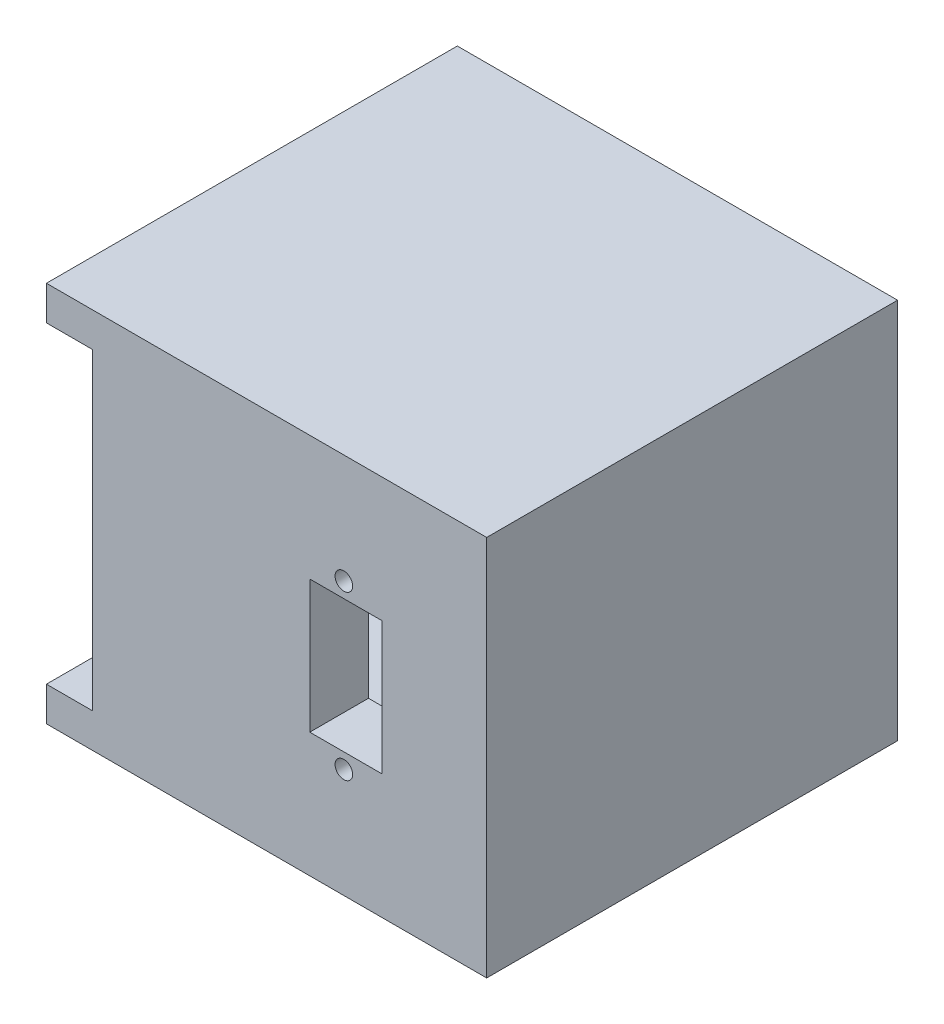
from build123d import *

# Parameters (mm, degrees)
SKIZZE1_W                       = 75
SKIZZE1_H                       = 65
AUFSATZ_LINEAR_AUSTRAGEN1_DEPTH = 70
SKIZZE4_W                       = 54.15
SKIZZE4_H                       = 53.3
SCHNITT_LINEAR_AUSTRAGEN1_DEPTH = 73
SKIZZE9_W                       = 3
SKIZZE9_H                       = 1
AUFSATZ_LINEAR_AUSTRAGEN2_DEPTH = 73
SCHNITT_LINEAR_AUSTRAGEN3_REACH = 117.974
SKIZZE12_W                      = 7.812260402
SKIZZE12_H                      = 53.3
SCHNITT_LINEAR_AUSTRAGEN4_REACH = 123.45
SKIZZE15_W                      = 12.3
SKIZZE15_H                      = 22.6


# Read off the part's stored shape, not the designer's step: Ø3.0 (3) Durchmesser Bohrung1, Ø3.0 (3) Durchmesser Bohrung2
with BuildPart() as part:
    # Skizze1 → Aufsatz-Linear austragen1 (new body)
    with BuildSketch(Plane.XY):
        with Locations((37.5, 32.5)):
            Rectangle(SKIZZE1_W, SKIZZE1_H)
    extrude(amount=AUFSATZ_LINEAR_AUSTRAGEN1_DEPTH)

    # Skizze4 → Schnitt-Linear austragen1 (cut)
    with BuildSketch(Plane.ZY):
        with Locations((32.925, 32.5)):
            Rectangle(SKIZZE4_W, SKIZZE4_H)
    extrude(amount=-SCHNITT_LINEAR_AUSTRAGEN1_DEPTH, mode=Mode.SUBTRACT)

    # Skizze9 → Aufsatz-Linear austragen2 (add)
    with BuildSketch(Plane.ZY):
        with Locations((12.35, 58.65)):
            Rectangle(SKIZZE9_W, SKIZZE9_H)
        with Locations((12.35, 6.35)):
            Rectangle(SKIZZE9_W, SKIZZE9_H)
    extrude(amount=-AUFSATZ_LINEAR_AUSTRAGEN2_DEPTH)

    # Skizze12 → Schnitt-Linear austragen3 (cut, up to next)
    with BuildSketch(Plane(origin=(0, 0, 60), x_dir=(-1, 0, 0), z_dir=(0, 0, -1)), mode=Mode.PRIVATE) as schnitt_linear_austragen3_sk1:
        with Locations((-3.906130201, 32.5)):
            Rectangle(SKIZZE12_W, SKIZZE12_H)
    schnitt_linear_austragen3_tool1 = extrude(schnitt_linear_austragen3_sk1.sketch, amount=-SCHNITT_LINEAR_AUSTRAGEN3_REACH, mode=Mode.PRIVATE) & part.part
    add(schnitt_linear_austragen3_tool1.solids().sort_by_distance((3.90613, 32.5, 60))[0], mode=Mode.SUBTRACT)

    # Ø3.0 (3) Durchmesser Bohrung1 outline → Ø3.0 (3) Durchmesser Bohrung1 (revolve, cut)
    with BuildSketch(Plane(origin=(50.669703956, 18.6, 0), x_dir=(1, 0, 0), z_dir=(0, -1, 0))):
        Polygon((0, 70), (0, 61.098709071), (1.5, 62), (1.5, 70), align=None)
    revolve(axis=Axis((50.669703956, 18.6, 0), (0, 0, 1)), mode=Mode.SUBTRACT)

    # 3.0 _3_ Durchmesser Bohrung1 2 outline → 3.0 _3_ Durchmesser Bohrung1 2 (revolve, cut)
    with BuildSketch(Plane(origin=(50.669703956, 46.4, 0), x_dir=(1, 0, 0), z_dir=(0, -1, 0))):
        Polygon((0, 70), (0, 61.098709071), (1.5, 62), (1.5, 70), align=None)
    revolve(axis=Axis((50.669703956, 46.4, 0), (0, 0, 1)), mode=Mode.SUBTRACT)

    # Skizze15 → Schnitt-Linear austragen4 (cut, up to next)
    with BuildSketch(Plane.XY.offset(70), mode=Mode.PRIVATE) as schnitt_linear_austragen4_sk1:
        with Locations((51.013730389, 32.5)):
            Rectangle(SKIZZE15_W, SKIZZE15_H)
    schnitt_linear_austragen4_tool1 = extrude(schnitt_linear_austragen4_sk1.sketch, amount=-SCHNITT_LINEAR_AUSTRAGEN4_REACH, mode=Mode.PRIVATE) & part.part
    add(schnitt_linear_austragen4_tool1.solids().sort_by_distance((51.01373, 32.5, 70))[0], mode=Mode.SUBTRACT)

    # Ø3.0 (3) Durchmesser Bohrung2 outline → Ø3.0 (3) Durchmesser Bohrung2 (revolve, cut)
    with BuildSketch(Plane(origin=(0, 62.075, 2.925), x_dir=(0, 1, 0), z_dir=(0, 0, -1))):
        Polygon((1.5, 8), (0, 8.901290929), (0, 0), (1.5, 0), align=None)
    revolve(axis=Axis((0, 62.075, 2.925), (1, 0, 0)), mode=Mode.SUBTRACT)

    # 3.0 _3_ Durchmesser Bohrung2 2 outline → 3.0 _3_ Durchmesser Bohrung2 2 (revolve, cut)
    with BuildSketch(Plane(origin=(0, 2.925, 2.925), x_dir=(0, 1, 0), z_dir=(0, 0, -1))):
        Polygon((1.5, 8), (0, 8.901290929), (0, 0), (1.5, 0), align=None)
    revolve(axis=Axis((0, 2.925, 2.925), (1, 0, 0)), mode=Mode.SUBTRACT)

    # 3.0 _3_ Durchmesser Bohrung2 3 outline → 3.0 _3_ Durchmesser Bohrung2 3 (revolve, cut)
    with BuildSketch(Plane(origin=(0, 2.925, 67.075), x_dir=(0, 1, 0), z_dir=(0, 0, -1))):
        Polygon((1.5, 8), (0, 8.901290929), (0, 0), (1.5, 0), align=None)
    revolve(axis=Axis((0, 2.925, 67.075), (1, 0, 0)), mode=Mode.SUBTRACT)

    # 3.0 _3_ Durchmesser Bohrung2 4 outline → 3.0 _3_ Durchmesser Bohrung2 4 (revolve, cut)
    with BuildSketch(Plane(origin=(0, 62.075, 67.075), x_dir=(0, 1, 0), z_dir=(0, 0, -1))):
        Polygon((1.5, 8), (0, 8.901290929), (0, 0), (1.5, 0), align=None)
    revolve(axis=Axis((0, 62.075, 67.075), (1, 0, 0)), mode=Mode.SUBTRACT)


solid = part.part
